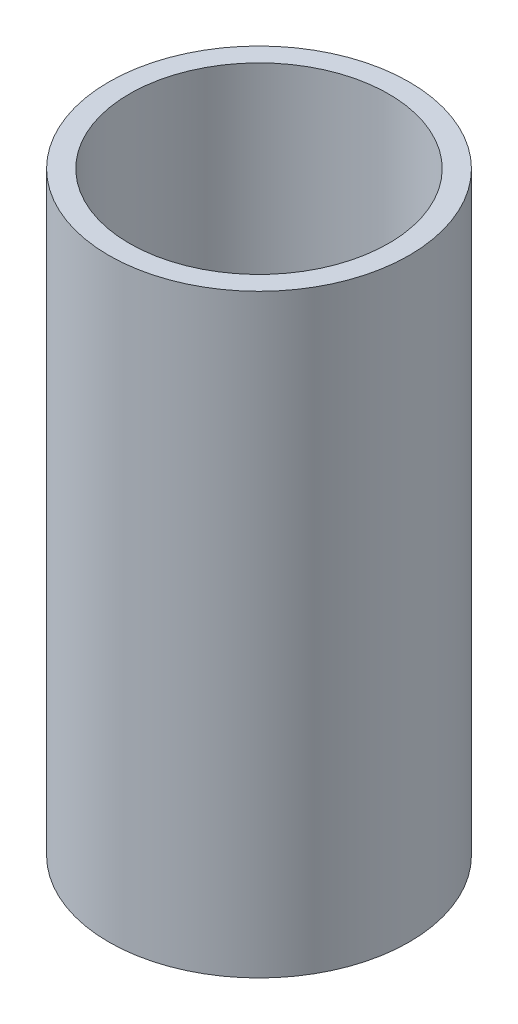
from build123d import *

# Parameters (mm, degrees)
SKETCH1_R           = 42.5
BOSS_EXTRUDE1_DEPTH = 168.237401893
SKETCH2_R           = 36.65838877
CUT_EXTRUDE1_DEPTH  = 179.651401885


with BuildPart() as part:
    # Sketch1 → Boss-Extrude1 (new body)
    with BuildSketch(Plane(origin=(0, 0, 0), x_dir=(1, 0, 0), z_dir=(0, 1, 0))):
        Circle(SKETCH1_R)
    extrude(amount=BOSS_EXTRUDE1_DEPTH)

    # Sketch2 → Cut-Extrude1 (cut, through all)
    with BuildSketch(Plane(origin=(0, 0, 0), x_dir=(1, 0, 0), z_dir=(0, 1, 0))):
        Circle(SKETCH2_R)
    extrude(amount=CUT_EXTRUDE1_DEPTH, mode=Mode.SUBTRACT)


solid = part.part
